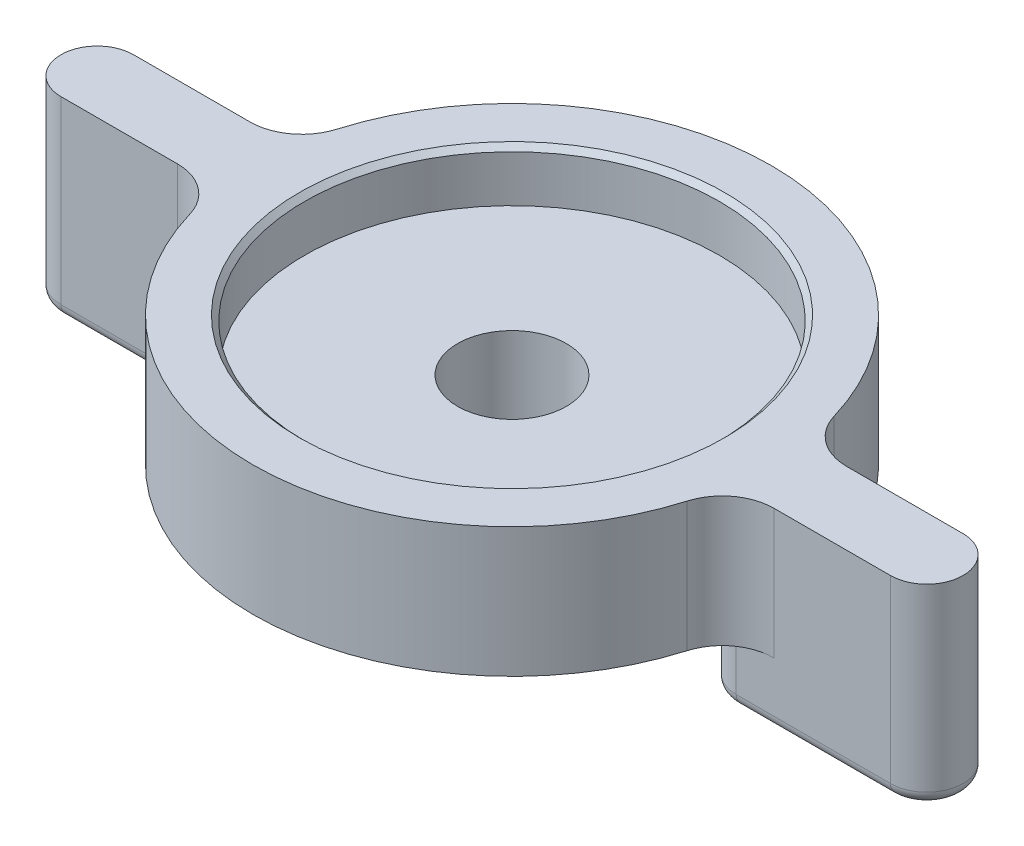
from build123d import *

# Parameters (mm, degrees)
ESQUISSE1_R        = 10
ESQUISSE1_R_2      = 2.1
BOSS_EXTRU_1_DEPTH = 3
BOSS_EXTRU_2_DEPTH = 5
BOSS_EXTRU_3_START = 2.45
BOSS_EXTRU_3_DEPTH = 2.45
ESQUISSE4_R        = 10
ESQUISSE4_R_2      = 8
BOSS_EXTRU_4_DEPTH = 2
CONG_5_R           = 2
CONG_6_R           = 2
CONG_7_R           = 2
CONG_8_R           = 2
CONG_10_R          = 0.5
CHANFREIN1_SIZE    = 0.2


with BuildPart() as part:
    # Esquisse1 → Boss.-Extru.1 (new body)
    with BuildSketch(Plane(origin=(0, 0, 0), x_dir=(1, 0, 0), z_dir=(0, 1, 0))):
        with Locations(Location((0, 0, 0), (0, 0, 270))):
            Circle(ESQUISSE1_R)
        with Locations(Location((0, 0, 0), (0, 0, 270))):
            Circle(ESQUISSE1_R_2, mode=Mode.SUBTRACT)
    extrude(amount=BOSS_EXTRU_1_DEPTH)

    # Esquisse2 → Boss.-Extru.2 (add)
    with BuildSketch(Plane(origin=(0, 0, 0), x_dir=(1, 0, 0), z_dir=(0, 1, 0))):
        with BuildLine():
            Line((-9.901515036, -1.4), (-16, -1.4))
            ThreePointArc((-16, -1.4), (-17.4, 0), (-16, 1.4))
            Line((-16, 1.4), (-9.901515036, 1.4))
            ThreePointArc((-9.901515036, 1.4), (-8.501515036, 0), (-9.901515036, -1.4))
        make_face()
        with BuildLine():
            Line((9.901515036, -1.4), (16, -1.4))
            ThreePointArc((16, -1.4), (17.4, 0), (16, 1.4))
            Line((16, 1.4), (9.901515036, 1.4))
            ThreePointArc((9.901515036, 1.4), (8.501515036, 0), (9.901515036, -1.4))
        make_face()
    extrude(amount=BOSS_EXTRU_2_DEPTH)

    # Esquisse3 → Boss.-Extru.3 (add)
    with BuildSketch(Plane.XZ.offset(BOSS_EXTRU_3_START)):
        with BuildLine():
            Line((-10.05, -1.4), (-16, -1.4))
            ThreePointArc((-16, -1.4), (-17.4, 0), (-16, 1.4))
            Line((-16, 1.4), (-10.05, 1.4))
            ThreePointArc((-10.05, 1.4), (-8.65, 0), (-10.05, -1.4))
        make_face()
        with BuildLine():
            Line((10.05, -1.4), (16, -1.4))
            ThreePointArc((16, -1.4), (17.4, 0), (16, 1.4))
            Line((16, 1.4), (10.05, 1.4))
            ThreePointArc((10.05, 1.4), (8.65, 0), (10.05, -1.4))
        make_face()
    extrude(amount=-BOSS_EXTRU_3_DEPTH)

    # Esquisse4 → Boss.-Extru.4 (add)
    with BuildSketch(Plane(origin=(0, 3, 0), x_dir=(1, 0, 0), z_dir=(0, 1, 0))):
        Circle(ESQUISSE4_R)
        with Locations(Location((0, 0, 0), (0, 0, 270))):
            Circle(ESQUISSE4_R_2, mode=Mode.SUBTRACT)
    extrude(amount=BOSS_EXTRU_4_DEPTH)

    # Congé5
    # the kernel refuses this fillet: 2 mm, written as the material it adds along each edge
    with BuildSketch(Plane(origin=(9.901515036, 5, -1.4), x_dir=(1, 0, 0), z_dir=(0, -1, 0))) as cong_5_piece_1:
        with BuildLine():
            CenterArc((1.606742869, -2), CONG_5_R, 90, 73.540750372)
            ThreePointArc((-0.311300115, -1.433333333), (-0.129335377, -0.72238185), (0, 0))
            Line((0, 0), (1.606742869, 0))
        make_face()
    extrude(amount=5)

    # Congé6
    # the kernel refuses this fillet: 2 mm, written as the material it adds along each edge
    with BuildSketch(Plane(origin=(9.901515036, 0, 1.4), x_dir=(1, 0, 0), z_dir=(0, 1, 0))) as cong_6_piece_1:
        with BuildLine():
            CenterArc((1.606742869, -2), CONG_6_R, 90, 73.540750372)
            ThreePointArc((-0.311300115, -1.433333333), (-0.129335377, -0.72238185), (0, 0))
            Line((0, 0), (1.606742869, 0))
        make_face()
    extrude(amount=5)

    # Congé7
    # the kernel refuses this fillet: 2 mm, written as the material it adds along each edge
    with BuildSketch(Plane(origin=(-9.901515036, 5, -1.4), x_dir=(0.2122381850229741, 0, -0.9772179658695156), z_dir=(0, -1, 0))) as cong_7_piece_1:
        with BuildLine():
            CenterArc((1.613423741, -1.994614368), CONG_7_R, 94.20570169, 73.540750372)
            Line((-0.34101219, -1.570137998), (0, 0))
            ThreePointArc((0, 0), (0.733374428, -0.026928159), (1.466748856, 0))
        make_face()
    extrude(amount=5)

    # Congé8
    # the kernel refuses this fillet: 2 mm, written as the material it adds along each edge
    with BuildSketch(Plane(origin=(-9.901515036, 5, 1.4), x_dir=(0.21223818502297503, 0, 0.9772179658695155), z_dir=(0, -1, 0))) as cong_8_piece_1:
        with BuildLine():
            CenterArc((1.613423741, 1.994614368), CONG_8_R, 192.253547938, 73.540750372)
            Line((-0.34101219, 1.570137998), (0, 0))
            ThreePointArc((0, 0), (0.733374428, 0.026928159), (1.466748856, 0))
        make_face()
    extrude(amount=5)

    # Congé10
    cong_10_edges = [part.edges().sort_by_distance(p)[0] for p in [
        (-8.65, -2.45, 0),
        (-13.025, -2.45, 1.4),
        (-17.4, -2.45, 0),
        (-13.025, -2.45, -1.4),
        (8.65, -2.45, 0),
        (13.025, -2.45, -1.4),
        (17.4, -2.45, 0),
        (13.025, -2.45, 1.4),
    ]]
    fillet(cong_10_edges, radius=CONG_10_R)

    # Chanfrein1
    chanfrein1_edges = [part.edges().sort_by_distance(p)[0] for p in [
        (0, 5, -8),
    ]]
    chamfer(chanfrein1_edges, length=CHANFREIN1_SIZE)


solid = part.part
